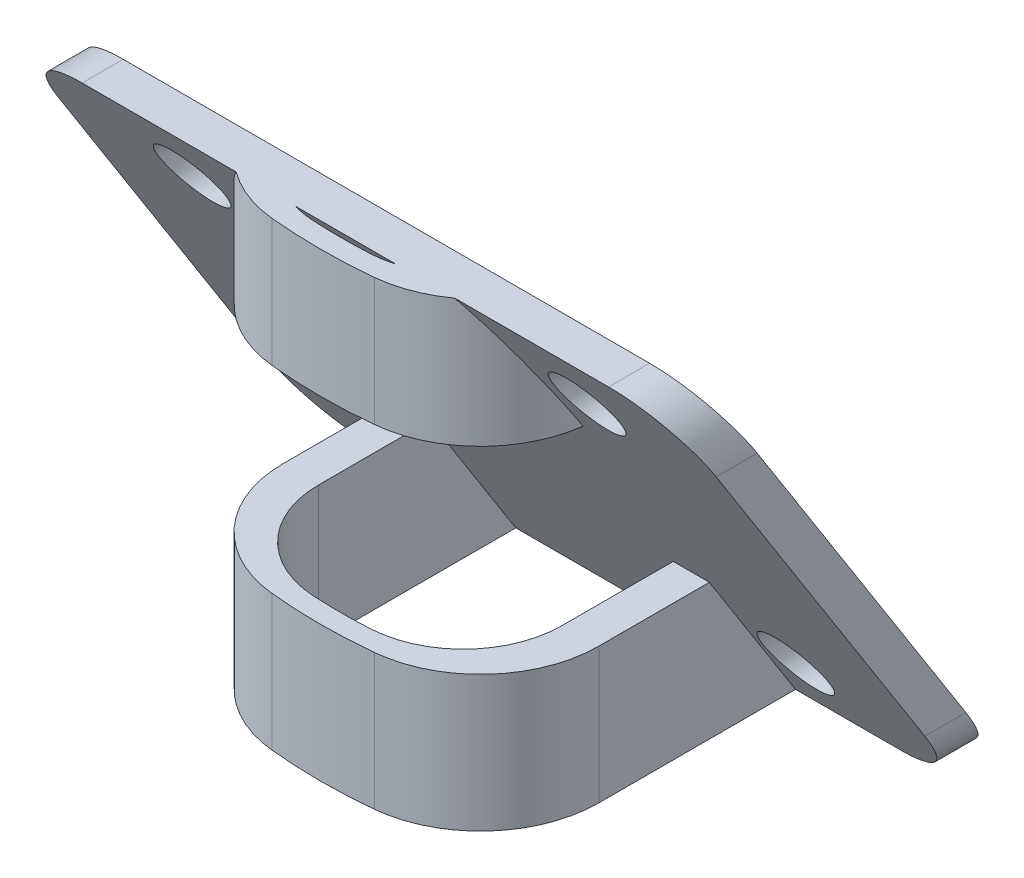
from build123d import *

# Parameters (mm, degrees)
BOSS_EXTRUDE1_DEPTH = 100
SKETCH2_R           = 5
CUT_EXTRUDE1_DEPTH  = 61
BOSS_EXTRUDE3_DEPTH = 70
BOSS_EXTRUDE4_REACH = 124.997
SKETCH4_W           = 48
SKETCH4_H           = 70
CUT_EXTRUDE2_REACH  = 131.834
FILLET1_R           = 10
CUT_EXTRUDE3_DEPTH  = 56
FILLET3_R           = 18
FILLET4_R           = 15
FILLET5_R           = 15


with BuildPart() as part:
    # Sketch1 → Boss-Extrude1 (new body)
    with BuildSketch(Plane(origin=(0, 0, 0), x_dir=(0, 0, -1), z_dir=(1, 0, 0))):
        Polygon((9.31960102, -5.422823355), (-6.40194197, 19.363300607), (-0.164443236, 19.363300607), (44.235722397, -50.636699393), (37.998223663, -50.636699393), (29.951005386, -37.94969088), align=None)
    extrude(amount=BOSS_EXTRUDE1_DEPTH)

    # Sketch2 → Cut-Extrude1 (cut)
    with BuildSketch(Plane(origin=(0, 0, -44.235722397), x_dir=(-1, 0, 0), z_dir=(0, 0, -1))):
        with Locations(Location((-80, -41.23638567, 0), (0, 0, 270))):
            Circle(SKETCH2_R)
        with Locations(Location((-20, -41.23638567, 0), (0, 0, 270))):
            Circle(SKETCH2_R)
        with Locations(Location((-20, 8.76361433, 0), (0, 0, 270))):
            Circle(SKETCH2_R)
        with Locations(Location((-80, 8.76361433, 0), (0, 0, 270))):
            Circle(SKETCH2_R)
    extrude(amount=-CUT_EXTRUDE1_DEPTH, mode=Mode.SUBTRACT)

    # Boss-Extrude4: up to this face of the body (flat: up to its plane)
    boss_extrude4_end = Plane(part.part.faces().sort_by_distance((50, -15.608520887, -15.780267556))[0])
    # Sketch4 → Boss-Extrude4 (add, up to the picked face)
    with BuildSketch(Plane(origin=(0, 0, 6.40194197), x_dir=(-1, 0, 0), z_dir=(0, 0, -1)), mode=Mode.PRIVATE) as boss_extrude4_sk1:
        with Locations((-50, -15.636699393)):
            Rectangle(SKETCH4_W, SKETCH4_H)
    boss_extrude4_tool1 = split(extrude(boss_extrude4_sk1.sketch, amount=BOSS_EXTRUDE4_REACH, mode=Mode.PRIVATE), bisect_by=boss_extrude4_end, keep=Keep.BOTH, mode=Mode.PRIVATE)


with BuildPart() as body_2:
    # Sketch3 → Boss-Extrude3 (new body)
    with BuildSketch(Plane(origin=(0, 19.363300607, 0), x_dir=(1, 0, 0), z_dir=(0, 1, 0))):
        with BuildLine():
            Line((26, -6.40194197), (74, -6.40194197))
            ThreePointArc((74, -6.40194197), (50, -10.164443236), (26, -6.40194197))
        make_face()
    extrude(amount=-BOSS_EXTRUDE3_DEPTH)


with BuildPart() as part_1:
    add(part.part)

    add(body_2.part)  # Boss-Extrude4 merges body 2
    add(boss_extrude4_tool1.solids().sort_by(Axis((50, -15.636699, 6.401942), (0, 0, -1)))[0])

    # Cut-Extrude2: up to this face of the body (flat: up to its plane)
    cut_extrude2_end = Plane(part_1.part.faces().sort_by_distance((87.661220736, -15.580052964, -15.762210692))[0])
    # Sketch5 → Cut-Extrude2 (cut, up to the picked face)
    with BuildSketch(Plane.XZ.offset(50.636699393), mode=Mode.PRIVATE) as cut_extrude2_sk1:
        with BuildLine():
            Line((68.503998914, -37.998223663), (31.496001086, -37.998223663))
            Line((31.496001086, -37.998223663), (31.496001086, 4.779601344))
            ThreePointArc((31.496001086, 4.779601344), (50, 7.087022557), (68.503998914, 4.779601344))
            Line((68.503998914, 4.779601344), (68.503998914, -37.998223663))
        make_face()
    cut_extrude2_tool1 = split(extrude(cut_extrude2_sk1.sketch, amount=-CUT_EXTRUDE2_REACH, mode=Mode.PRIVATE), bisect_by=cut_extrude2_end, keep=Keep.BOTH, mode=Mode.PRIVATE)
    add(cut_extrude2_tool1.solids().sort_by(Axis((50, -50.636699, -15.832469), (0, 1, 0)))[0], mode=Mode.SUBTRACT)

    # Fillet1
    # the kernel refuses this fillet: 10 mm, written as the material it takes off along each edge
    with BuildSketch(Plane(origin=(100, -50.636699393, -69.235722397), x_dir=(-1, 0, 0), z_dir=(0, 0, 1)), Plane(origin=(100, 19.363300607, 31.40194197), x_dir=(-1, 0, 0), z_dir=(0, 0, -1))) as fillet1_piece_1:
        with BuildLine():
            CenterArc((FILLET1_R, -FILLET1_R), FILLET1_R, 90, 90)
            Line((0, -FILLET1_R), (0, 0))
            Line((0, 0), (FILLET1_R, 0))
        make_face()
    extrude(amount=56.237498734, mode=Mode.SUBTRACT)
    with BuildSketch(Plane(origin=(0, -50.636699393, -69.235722397), x_dir=(1, 0, 0), z_dir=(0, 0, 1)), Plane(origin=(0, 19.363300607, 31.40194197), x_dir=(1, 0, 0), z_dir=(0, 0, -1))) as fillet1_piece_2:
        with BuildLine():
            CenterArc((FILLET1_R, FILLET1_R), FILLET1_R, 180, 90)
            Line((0, FILLET1_R), (0, 0))
            Line((0, 0), (FILLET1_R, 0))
        make_face()
    extrude(amount=56.237498734, mode=Mode.SUBTRACT)

    # Sketch7 → Cut-Extrude3 (cut)
    with BuildSketch(Plane(origin=(74, 0, 0), x_dir=(0, 0, -1), z_dir=(1, 0, 0))):
        Polygon((5.879968804, 0), (-34.029101203, 0), (-34.029101203, -30), (24.908611218, -30), align=None)
    extrude(amount=-CUT_EXTRUDE3_DEPTH, mode=Mode.SUBTRACT)

    # Fillet3
    # the kernel refuses this fillet: 18 mm, written as the material it takes off along each edge
    with BuildSketch(Plane(origin=(74, 60.763896609, 6.40194197), x_dir=(-0.9790132085588953, 0, 0.20379680435967867), z_dir=(0, -1, 0))) as fillet3_piece_1_section:
        with BuildLine():
            CenterArc((14.659822692, 17.8993972), FILLET3_R, 191.759074187, 84.301431918)
            Line((-2.962415062, 14.231054722), (0, 0))
            ThreePointArc((0, 0), (8.2801192, -0.43832682), (16.560238401, 0))
        make_face()
    fillet3_piece_1 = extrude(amount=102.16449261, mode=Mode.PRIVATE)
    fillet3_piece_1 = split(fillet3_piece_1, bisect_by=Plane(origin=(69.993439145, 10.97404697, 1.080738384), z_dir=(0, -0.5356273864218708, 0.8444544409942292)), keep=Keep.TOP, mode=Mode.PRIVATE)
    add(fillet3_piece_1, mode=Mode.SUBTRACT)
    with BuildSketch(Plane(origin=(74, 11.400596002, 6.40194197), x_dir=(-0.9790132085588953, 0, 0.2037968043596786), z_dir=(0, -1, 0))) as fillet3_piece_2_section:
        with BuildLine():
            CenterArc((14.659822692, 17.8993972), FILLET3_R, 191.759074187, 84.301431918)
            Line((-2.962415062, 14.231054722), (0, 0))
            ThreePointArc((0, 0), (8.2801192, -0.43832682), (16.560238401, 0))
        make_face()
    fillet3_piece_2 = extrude(amount=103.437891396, mode=Mode.PRIVATE)
    fillet3_piece_2 = split(fillet3_piece_2, bisect_by=Plane(origin=(70.341248141, 8.727743457, -0.34406516), z_dir=(0, -0.5356273864218708, 0.8444544409942292)), keep=Keep.TOP, mode=Mode.PRIVATE)
    add(fillet3_piece_2, mode=Mode.SUBTRACT)
    with BuildSketch(Plane(origin=(26, 11.400596002, 6.40194197), x_dir=(0, 0, -1), z_dir=(0, -1, 0))) as fillet3_piece_3_section:
        with BuildLine():
            CenterArc((14.536121267, 18), FILLET3_R, 185.698568082, 84.301431918)
            ThreePointArc((-3.374923665, 16.212692131), (-2.116589579, 8.01701646), (0, 0))
            Line((0, 0), (14.536121267, 0))
        make_face()
    fillet3_piece_3 = extrude(amount=103.437891396, mode=Mode.PRIVATE)
    fillet3_piece_3 = split(fillet3_piece_3, bisect_by=Plane(origin=(29.658751859, 8.727743457, -0.344065159), z_dir=(0, -0.5356273864218708, 0.8444544409942292)), keep=Keep.TOP, mode=Mode.PRIVATE)
    add(fillet3_piece_3, mode=Mode.SUBTRACT)
    with BuildSketch(Plane(origin=(26, 60.763896609, 6.40194197), x_dir=(0, 0, -1), z_dir=(0, -1, 0))) as fillet3_piece_4_section:
        with BuildLine():
            CenterArc((14.536121267, 18), FILLET3_R, 185.698568082, 84.301431918)
            ThreePointArc((-3.374923665, 16.212692131), (-2.116589579, 8.01701646), (0, 0))
            Line((0, 0), (14.536121267, 0))
        make_face()
    fillet3_piece_4 = extrude(amount=102.16449261, mode=Mode.PRIVATE)
    fillet3_piece_4 = split(fillet3_piece_4, bisect_by=Plane(origin=(30.006560852, 10.974046968, 1.080738383), z_dir=(0, -0.5356273864218708, 0.8444544409942292)), keep=Keep.TOP, mode=Mode.PRIVATE)
    add(fillet3_piece_4, mode=Mode.SUBTRACT)

    # Fillet4
    fillet4_edges = [part_1.edges().sort_by_distance(p)[0] for p in [
        (68.503998914, -40.318349696, 4.779601344),
        (31.496001086, -40.318349696, 4.779601344),
    ]]
    fillet(fillet4_edges, radius=FILLET4_R)

    # Fillet5
    # the kernel refuses this fillet: 15 mm, written as the material it adds along each edge
    with BuildSketch(Plane(origin=(68.503998914, 0, 4.779601344), x_dir=(0, 0, -1), z_dir=(0, 1, 0))) as fillet5_piece_1_section:
        with BuildLine():
            CenterArc((12.794390285, 15), FILLET5_R, 183.32861315, 86.67138685)
            ThreePointArc((-2.18030389, 14.12906122), (-1.426006953, 7.012703672), (0, 0))
            Line((0, 0), (12.794390285, 0))
        make_face()
    fillet5_piece_1 = extrude(amount=52.546307376, mode=Mode.PRIVATE)
    fillet5_piece_1 = split(fillet5_piece_1, bisect_by=Plane(origin=(64.873583949, 12.366179926, -4.273747009), z_dir=(0, -0.5356273864218707, 0.8444544409942292)), keep=Keep.TOP, mode=Mode.PRIVATE)
    fillet5_piece_1 = split(fillet5_piece_1, bisect_by=Plane(origin=(64.873583949, 19.363300607, 3.531905566), z_dir=(0, -1, 0)), keep=Keep.TOP, mode=Mode.PRIVATE)
    add(fillet5_piece_1)
    with BuildSketch(Plane(origin=(31.496001086, 0, 4.779601344), x_dir=(0.9883021898179025, 0, 0.15250830010572736), z_dir=(0, 1, 0))) as fillet5_piece_2_section:
        with BuildLine():
            CenterArc((12.873282134, 14.932348438), FILLET5_R, 188.772314309, 86.67138685)
            Line((-1.951250713, 12.644723937), (0, 0))
            ThreePointArc((0, 0), (7.148148292, -0.339830278), (14.296296583, 0))
        make_face()
    fillet5_piece_2 = extrude(amount=52.546307376, mode=Mode.PRIVATE)
    fillet5_piece_2 = split(fillet5_piece_2, bisect_by=Plane(origin=(35.126416052, 12.366179929, -4.273747008), z_dir=(0, -0.5356273864218707, 0.8444544409942292)), keep=Keep.TOP, mode=Mode.PRIVATE)
    fillet5_piece_2 = split(fillet5_piece_2, bisect_by=Plane(origin=(35.126416052, 19.363300607, 3.531905566), z_dir=(0, -1, 0)), keep=Keep.TOP, mode=Mode.PRIVATE)
    add(fillet5_piece_2)


solid = part_1.part
